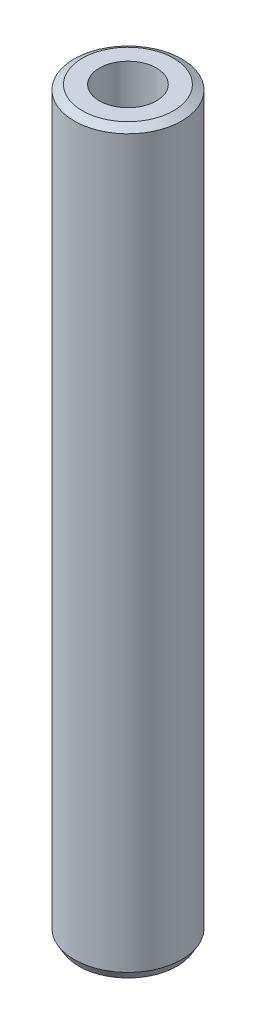
from build123d import *
from OCP.BRepFilletAPI import BRepFilletAPI_MakeChamfer

# Parameters (mm, degrees)
SKETCH1_R           = 5
BOSS_EXTRUDE1_DEPTH = 68.709733367
SKETCH2_R           = 2.651664268
CUT_EXTRUDE1_DEPTH  = 70.072624529
CHAMFER1_SIZE       = 0.439297462
CHAMFER1_SIZE2      = 0.760885524


with BuildPart() as part:
    # Sketch1 → Boss-Extrude1 (new body)
    with BuildSketch(Plane(origin=(0, 0, 0), x_dir=(1, 0, 0), z_dir=(0, 1, 0))):
        Circle(SKETCH1_R)
    extrude(amount=BOSS_EXTRUDE1_DEPTH)

    # Sketch2 → Cut-Extrude1 (cut, through all)
    with BuildSketch(Plane(origin=(0, 0, 0), x_dir=(1, 0, 0), z_dir=(0, 1, 0))):
        Circle(SKETCH2_R)
    extrude(amount=CUT_EXTRUDE1_DEPTH, mode=Mode.SUBTRACT)

    # Chamfer1: one chamfer whose edges measure the first distance from different faces: ONE call of the kernel's chamfer builder (chamfer() names one face for all edges)
    chamfer1_edges_1 = [part.edges().sort_by_distance(p)[0] for p in [
        (-5, 68.709733367, 0),
    ]]
    chamfer1_side_1 = [part.faces().sort_by_distance(p)[0] for p in [
        (-5, 34.354866683, 0),
    ]]
    chamfer1_edges_2 = [part.edges().sort_by_distance(p)[0] for p in [
        (-5, 0, 0),
    ]]
    chamfer1_side_2 = [part.faces().sort_by_distance(p)[0] for p in [
        (-4.858578644, 0, 0),
    ]]
    chamfer1 = BRepFilletAPI_MakeChamfer(part.part.solid().wrapped)
    for e in chamfer1_edges_1:
        chamfer1.Add(CHAMFER1_SIZE, CHAMFER1_SIZE2, e.wrapped, chamfer1_side_1[0].wrapped)  # the first distance lies on this face
    for e in chamfer1_edges_2:
        chamfer1.Add(CHAMFER1_SIZE, CHAMFER1_SIZE2, e.wrapped, chamfer1_side_2[0].wrapped)  # the first distance lies on this face
    add(Compound.cast(chamfer1.Shape()), mode=Mode.REPLACE)


solid = part.part
